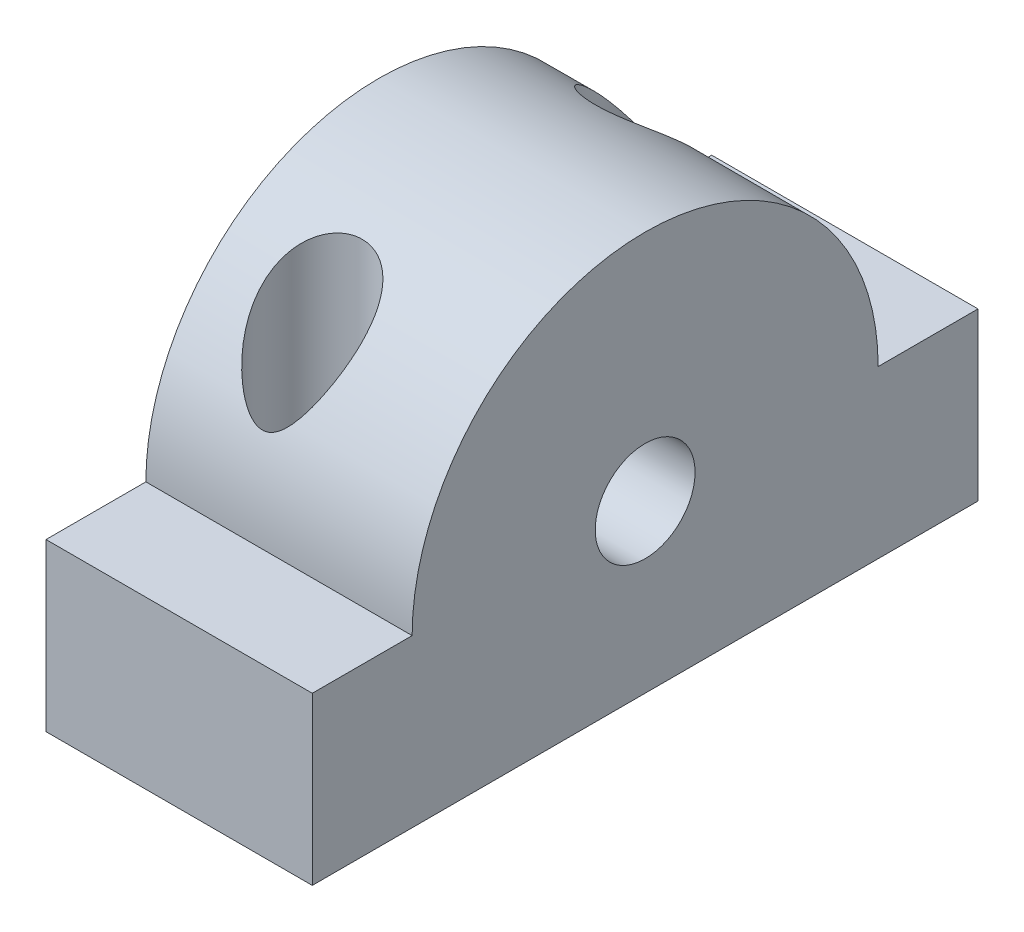
from build123d import *

# Parameters (mm, degrees)
BOSS_EXTRUDE1_DEPTH = 8
SKETCH3_R           = 1.5
CUT_EXTRUDE1_DEPTH  = 15
SKETCH4_R           = 1.5
CUT_EXTRUDE2_DEPTH  = 10


with BuildPart() as part:
    # Sketch1 → Boss-Extrude1 (new body)
    with BuildSketch(Plane(origin=(0, 0, 0), x_dir=(0, 0, -1), z_dir=(1, 0, 0))):
        with BuildLine():
            Line((17, 0), (20, 0))
            Line((20, 0), (20, -5))
            Line((20, -5), (0, -5))
            Line((0, -5), (0, 0))
            Line((0, 0), (3, 0))
            ThreePointArc((3, 0), (10, 7), (17, 0))
        make_face()
    extrude(amount=BOSS_EXTRUDE1_DEPTH)

    # Sketch3 → Cut-Extrude1 (cut)
    with BuildSketch(Plane.XZ.offset(5)):
        with Locations((3, -5)):
            Circle(SKETCH3_R)
        with Locations((3, -15)):
            Circle(SKETCH3_R)
    extrude(amount=-CUT_EXTRUDE1_DEPTH, mode=Mode.SUBTRACT)

    # Sketch4 → Cut-Extrude2 (cut)
    with BuildSketch(Plane(origin=(8, 0, 0), x_dir=(0, 0, -1), z_dir=(1, 0, 0))):
        with Locations((10, 0)):
            Circle(SKETCH4_R)
    extrude(amount=-CUT_EXTRUDE2_DEPTH, mode=Mode.SUBTRACT)


solid = part.part
